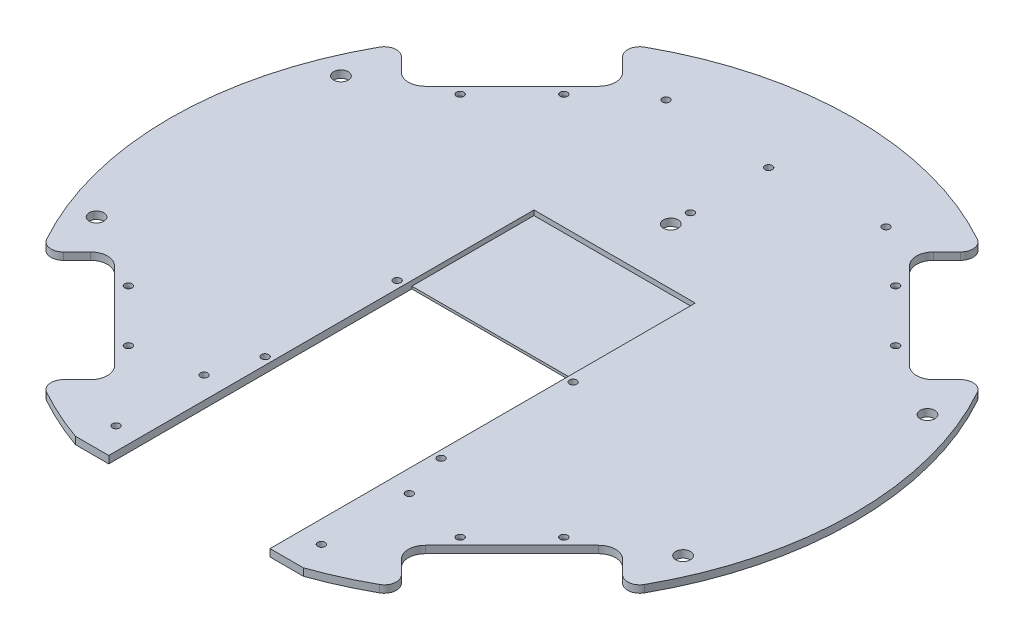
from build123d import *

# Parameters (mm, degrees)
SKETCH1_R                = 140
BOSS_EXTRUDE1_DEPTH      = 3
CUT_EXTRUDE4_REACH       = 200.013
CUT_EXTRUDE6_REACH       = 200.013
SKETCH9_R                = 1.5
FILLET1_R                = 5
CIRPATTERN1_COUNT        = 4
FILLET1_OF_CIRPATTERN1_R = 5
CUT_EXTRUDE1_REACH       = 200.013
FILLET3_R                = 1.5
CUT_EXTRUDE7_REACH       = 200.013
SKETCH10_R               = 1.5
CUT_EXTRUDE9_REACH       = 200.013
SKETCH13_R               = 1.5
CUT_EXTRUDE12_REACH      = 200.013
SKETCH16_R               = 1.5
SKETCH16_R_2             = 3
CUT_EXTRUDE13_REACH      = 200.013
SKETCH17_R               = 3
SKETCH18_W               = 66
SKETCH18_H               = 50
CUT_EXTRUDE14_DEPTH      = 2


with BuildPart() as part:
    # Sketch1 → Boss-Extrude1 (new body)
    with BuildSketch(Plane(origin=(0, 0, 0), x_dir=(1, 0, 0), z_dir=(0, 1, 0))):
        Circle(SKETCH1_R)
    extrude(amount=BOSS_EXTRUDE1_DEPTH)

    # Sketch7 → Cut-Extrude4 (cut, up to next)
    with BuildSketch(Plane(origin=(0, 3, 0), x_dir=(1, 0, 0), z_dir=(0, 1, 0)), mode=Mode.PRIVATE) as cut_extrude4_sk1:
        with BuildLine():
            Line((-99.030304705, -63.604254968), (-63.604254968, -99.030304705))
            ThreePointArc((-63.604254968, -99.030304705), (-61.568647097, -103.944696834), (-63.604254968, -108.859088964))
            Line((-63.604254968, -108.859088964), (-76.367532368, -121.622366364))
            Line((-76.367532368, -121.622366364), (-121.622366364, -76.367532368))
            Line((-121.622366364, -76.367532368), (-108.859088964, -63.604254968))
            ThreePointArc((-108.859088964, -63.604254968), (-103.944696834, -61.568647097), (-99.030304705, -63.604254968))
        make_face()
    cut_extrude4_tool1 = extrude(cut_extrude4_sk1.sketch, amount=-CUT_EXTRUDE4_REACH, mode=Mode.PRIVATE) & part.part
    cut_extrude4 = cut_extrude4_tool1.solids().sort_by_distance((-90.257735, 3, 90.257735))[0]
    add(cut_extrude4, mode=Mode.SUBTRACT)

    # Sketch9 → Cut-Extrude6 (cut, up to next)
    with BuildSketch(Plane(origin=(0, 3, 0), x_dir=(1, 0, 0), z_dir=(0, 1, 0)), mode=Mode.PRIVATE) as cut_extrude6_sk1:
        with Locations((-89.09545443, -67.882250994)):
            Circle(SKETCH9_R)
    cut_extrude6_tool1 = extrude(cut_extrude6_sk1.sketch, amount=-CUT_EXTRUDE6_REACH, mode=Mode.PRIVATE) & part.part
    # Sketch9 → Cut-Extrude6 (cut, up to next)
    with BuildSketch(Plane(origin=(0, 3, 0), x_dir=(1, 0, 0), z_dir=(0, 1, 0)), mode=Mode.PRIVATE) as cut_extrude6_sk2:
        with Locations((-67.882250994, -89.09545443)):
            Circle(SKETCH9_R)
    cut_extrude6_tool2 = extrude(cut_extrude6_sk2.sketch, amount=-CUT_EXTRUDE6_REACH, mode=Mode.PRIVATE) & part.part
    cut_extrude6_1 = cut_extrude6_tool1.solids().sort_by_distance((-89.095454, 3, 67.882251))[0]
    add(cut_extrude6_1, mode=Mode.SUBTRACT)
    cut_extrude6_2 = cut_extrude6_tool2.solids().sort_by_distance((-67.882251, 3, 89.095454))[0]
    add(cut_extrude6_2, mode=Mode.SUBTRACT)
    cut_extrude6 = cut_extrude6_1 + cut_extrude6_2  # Cut-Extrude6 as one shape, for the pattern or mirror that repeats it

    # Fillet1
    fillet1_edges = [part.edges().sort_by_distance(p)[0] for p in [
        (-73.746853427, 1.5, 119.001687423),
        (-119.001687423, 1.5, 73.746853427),
    ]]
    fillet(fillet1_edges, radius=FILLET1_R)

    # CirPattern1: Cut-Extrude4, Cut-Extrude6 ×4 about axis
    cirpattern1_axis = Axis((0, 3, 0), (0, 1, 0))
    add([cut_extrude4.rotate(cirpattern1_axis, i * 360 / CIRPATTERN1_COUNT) for i in range(1, CIRPATTERN1_COUNT)], mode=Mode.SUBTRACT)
    add([cut_extrude6.rotate(cirpattern1_axis, i * 360 / CIRPATTERN1_COUNT) for i in range(1, CIRPATTERN1_COUNT)], mode=Mode.SUBTRACT)

    # Fillet1 of CirPattern1
    fillet1_of_cirpattern1_edges = [part.edges().sort_by_distance(p)[0] for p in [
        (119.001687423, 1.5, 73.746853427),
        (73.746853427, 1.5, 119.001687423),
        (73.746853427, 1.5, -119.001687423),
        (119.001687423, 1.5, -73.746853427),
        (-119.001687423, 1.5, -73.746853427),
        (-73.746853427, 1.5, -119.001687423),
    ]]
    fillet(fillet1_of_cirpattern1_edges, radius=FILLET1_OF_CIRPATTERN1_R)

    # Sketch2 → Cut-Extrude1 (cut, up to next)
    with BuildSketch(Plane(origin=(0, 3, 0), x_dir=(1, 0, 0), z_dir=(0, 1, 0)), mode=Mode.PRIVATE) as cut_extrude1_sk1:
        Polygon((-46.647615159, -132), (-33, -132), (-33, -8), (33, -8), (33, -132), (46.647615159, -132), (46.647615159, -140), (-46.647615159, -140), align=None)
    cut_extrude1_tool1 = extrude(cut_extrude1_sk1.sketch, amount=-CUT_EXTRUDE1_REACH, mode=Mode.PRIVATE) & part.part
    add(cut_extrude1_tool1.solids().sort_by_distance((0, 3, 75.516001))[0], mode=Mode.SUBTRACT)

    # Fillet3
    fillet3_edges = [part.edges().sort_by_distance(p)[0] for p in [
        (67.882250994, 0, 90.59545443),
        (89.09545443, 0, 69.382250994),
        (90.59545443, 0, -67.882250994),
        (69.382250994, 0, -89.09545443),
        (-67.882250994, 0, -90.59545443),
        (-89.09545443, 0, -69.382250994),
        (-69.382250994, 0, 89.09545443),
        (-90.59545443, 0, 67.882250994),
    ]]
    fillet(fillet3_edges, radius=FILLET3_R)

    # Sketch10 → Cut-Extrude7 (cut, up to next)
    with BuildSketch(Plane(origin=(0, 3, 0), x_dir=(1, 0, 0), z_dir=(0, 1, 0)), mode=Mode.PRIVATE) as cut_extrude7_sk1:
        with Locations((-36, -65)):
            Circle(SKETCH10_R)
    cut_extrude7_tool1 = extrude(cut_extrude7_sk1.sketch, amount=-CUT_EXTRUDE7_REACH, mode=Mode.PRIVATE) & part.part
    # Sketch10 → Cut-Extrude7 (cut, up to next)
    with BuildSketch(Plane(origin=(0, 3, 0), x_dir=(1, 0, 0), z_dir=(0, 1, 0)), mode=Mode.PRIVATE) as cut_extrude7_sk2:
        with Locations((36, -65)):
            Circle(SKETCH10_R)
    cut_extrude7_tool2 = extrude(cut_extrude7_sk2.sketch, amount=-CUT_EXTRUDE7_REACH, mode=Mode.PRIVATE) & part.part
    # Sketch10 → Cut-Extrude7 (cut, up to next)
    with BuildSketch(Plane(origin=(0, 3, 0), x_dir=(1, 0, 0), z_dir=(0, 1, 0)), mode=Mode.PRIVATE) as cut_extrude7_sk3:
        with Locations((-36, -11)):
            Circle(SKETCH10_R)
    cut_extrude7_tool3 = extrude(cut_extrude7_sk3.sketch, amount=-CUT_EXTRUDE7_REACH, mode=Mode.PRIVATE) & part.part
    # Sketch10 → Cut-Extrude7 (cut, up to next)
    with BuildSketch(Plane(origin=(0, 3, 0), x_dir=(1, 0, 0), z_dir=(0, 1, 0)), mode=Mode.PRIVATE) as cut_extrude7_sk4:
        with Locations((36, -11)):
            Circle(SKETCH10_R)
    cut_extrude7_tool4 = extrude(cut_extrude7_sk4.sketch, amount=-CUT_EXTRUDE7_REACH, mode=Mode.PRIVATE) & part.part
    add(cut_extrude7_tool1.solids().sort_by_distance((-36, 3, 65))[0], mode=Mode.SUBTRACT)
    add(cut_extrude7_tool2.solids().sort_by_distance((36, 3, 65))[0], mode=Mode.SUBTRACT)
    add(cut_extrude7_tool3.solids().sort_by_distance((-36, 3, 11))[0], mode=Mode.SUBTRACT)
    add(cut_extrude7_tool4.solids().sort_by_distance((36, 3, 11))[0], mode=Mode.SUBTRACT)

    # Sketch13 → Cut-Extrude9 (cut, up to next)
    with BuildSketch(Plane(origin=(0, 3, 0), x_dir=(1, 0, 0), z_dir=(0, 1, 0)), mode=Mode.PRIVATE) as cut_extrude9_sk1:
        with Locations((-42, -84)):
            Circle(SKETCH13_R)
    cut_extrude9_tool1 = extrude(cut_extrude9_sk1.sketch, amount=-CUT_EXTRUDE9_REACH, mode=Mode.PRIVATE) & part.part
    # Sketch13 → Cut-Extrude9 (cut, up to next)
    with BuildSketch(Plane(origin=(0, 3, 0), x_dir=(1, 0, 0), z_dir=(0, 1, 0)), mode=Mode.PRIVATE) as cut_extrude9_sk2:
        with Locations((-42, -120)):
            Circle(SKETCH13_R)
    cut_extrude9_tool2 = extrude(cut_extrude9_sk2.sketch, amount=-CUT_EXTRUDE9_REACH, mode=Mode.PRIVATE) & part.part
    # Sketch13 → Cut-Extrude9 (cut, up to next)
    with BuildSketch(Plane(origin=(0, 3, 0), x_dir=(1, 0, 0), z_dir=(0, 1, 0)), mode=Mode.PRIVATE) as cut_extrude9_sk3:
        with Locations((42, -120)):
            Circle(SKETCH13_R)
    cut_extrude9_tool3 = extrude(cut_extrude9_sk3.sketch, amount=-CUT_EXTRUDE9_REACH, mode=Mode.PRIVATE) & part.part
    # Sketch13 → Cut-Extrude9 (cut, up to next)
    with BuildSketch(Plane(origin=(0, 3, 0), x_dir=(1, 0, 0), z_dir=(0, 1, 0)), mode=Mode.PRIVATE) as cut_extrude9_sk4:
        with Locations((42, -84)):
            Circle(SKETCH13_R)
    cut_extrude9_tool4 = extrude(cut_extrude9_sk4.sketch, amount=-CUT_EXTRUDE9_REACH, mode=Mode.PRIVATE) & part.part
    add(cut_extrude9_tool1.solids().sort_by_distance((-42, 3, 84))[0], mode=Mode.SUBTRACT)
    add(cut_extrude9_tool2.solids().sort_by_distance((-42, 3, 120))[0], mode=Mode.SUBTRACT)
    add(cut_extrude9_tool3.solids().sort_by_distance((42, 3, 120))[0], mode=Mode.SUBTRACT)
    add(cut_extrude9_tool4.solids().sort_by_distance((42, 3, 84))[0], mode=Mode.SUBTRACT)

    # Sketch16 → Cut-Extrude12 (cut, up to next)
    with BuildSketch(Plane(origin=(0, 3, 0), x_dir=(1, 0, 0), z_dir=(0, 1, 0)), mode=Mode.PRIVATE) as cut_extrude12_sk1:
        with Locations((0, 73)):
            Circle(SKETCH16_R)
    cut_extrude12_tool1 = extrude(cut_extrude12_sk1.sketch, amount=-CUT_EXTRUDE12_REACH, mode=Mode.PRIVATE) & part.part
    # Sketch16 → Cut-Extrude12 (cut, up to next)
    with BuildSketch(Plane(origin=(0, 3, 0), x_dir=(1, 0, 0), z_dir=(0, 1, 0)), mode=Mode.PRIVATE) as cut_extrude12_sk2:
        with Locations((-45, 108)):
            Circle(SKETCH16_R)
    cut_extrude12_tool2 = extrude(cut_extrude12_sk2.sketch, amount=-CUT_EXTRUDE12_REACH, mode=Mode.PRIVATE) & part.part
    # Sketch16 → Cut-Extrude12 (cut, up to next)
    with BuildSketch(Plane(origin=(0, 3, 0), x_dir=(1, 0, 0), z_dir=(0, 1, 0)), mode=Mode.PRIVATE) as cut_extrude12_sk3:
        with Locations((45, 108)):
            Circle(SKETCH16_R)
    cut_extrude12_tool3 = extrude(cut_extrude12_sk3.sketch, amount=-CUT_EXTRUDE12_REACH, mode=Mode.PRIVATE) & part.part
    # Sketch16 → Cut-Extrude12 (cut, up to next)
    with BuildSketch(Plane(origin=(0, 3, 0), x_dir=(1, 0, 0), z_dir=(0, 1, 0)), mode=Mode.PRIVATE) as cut_extrude12_sk4:
        with Locations((0, 105)):
            Circle(SKETCH16_R)
    cut_extrude12_tool4 = extrude(cut_extrude12_sk4.sketch, amount=-CUT_EXTRUDE12_REACH, mode=Mode.PRIVATE) & part.part
    # Sketch16 → Cut-Extrude12 (cut, up to next)
    with BuildSketch(Plane(origin=(0, 3, 0), x_dir=(1, 0, 0), z_dir=(0, 1, 0)), mode=Mode.PRIVATE) as cut_extrude12_sk5:
        with Locations((0, 65)):
            Circle(SKETCH16_R_2)
    cut_extrude12_tool5 = extrude(cut_extrude12_sk5.sketch, amount=-CUT_EXTRUDE12_REACH, mode=Mode.PRIVATE) & part.part
    add(cut_extrude12_tool1.solids().sort_by_distance((0, 3, -73))[0], mode=Mode.SUBTRACT)
    add(cut_extrude12_tool2.solids().sort_by_distance((-45, 3, -108))[0], mode=Mode.SUBTRACT)
    add(cut_extrude12_tool3.solids().sort_by_distance((45, 3, -108))[0], mode=Mode.SUBTRACT)
    add(cut_extrude12_tool4.solids().sort_by_distance((0, 3, -105))[0], mode=Mode.SUBTRACT)
    add(cut_extrude12_tool5.solids().sort_by_distance((0, 3, -65))[0], mode=Mode.SUBTRACT)

    # Sketch17 → Cut-Extrude13 (cut, up to next)
    with BuildSketch(Plane(origin=(0, 3, 0), x_dir=(1, 0, 0), z_dir=(0, 1, 0)), mode=Mode.PRIVATE) as cut_extrude13_sk1:
        with Locations((-120, 50)):
            Circle(SKETCH17_R)
    cut_extrude13_tool1 = extrude(cut_extrude13_sk1.sketch, amount=-CUT_EXTRUDE13_REACH, mode=Mode.PRIVATE) & part.part
    # Sketch17 → Cut-Extrude13 (cut, up to next)
    with BuildSketch(Plane(origin=(0, 3, 0), x_dir=(1, 0, 0), z_dir=(0, 1, 0)), mode=Mode.PRIVATE) as cut_extrude13_sk2:
        with Locations((-120, -50)):
            Circle(SKETCH17_R)
    cut_extrude13_tool2 = extrude(cut_extrude13_sk2.sketch, amount=-CUT_EXTRUDE13_REACH, mode=Mode.PRIVATE) & part.part
    # Sketch17 → Cut-Extrude13 (cut, up to next)
    with BuildSketch(Plane(origin=(0, 3, 0), x_dir=(1, 0, 0), z_dir=(0, 1, 0)), mode=Mode.PRIVATE) as cut_extrude13_sk3:
        with Locations((120, 50)):
            Circle(SKETCH17_R)
    cut_extrude13_tool3 = extrude(cut_extrude13_sk3.sketch, amount=-CUT_EXTRUDE13_REACH, mode=Mode.PRIVATE) & part.part
    # Sketch17 → Cut-Extrude13 (cut, up to next)
    with BuildSketch(Plane(origin=(0, 3, 0), x_dir=(1, 0, 0), z_dir=(0, 1, 0)), mode=Mode.PRIVATE) as cut_extrude13_sk4:
        with Locations((120, -50)):
            Circle(SKETCH17_R)
    cut_extrude13_tool4 = extrude(cut_extrude13_sk4.sketch, amount=-CUT_EXTRUDE13_REACH, mode=Mode.PRIVATE) & part.part
    add(cut_extrude13_tool1.solids().sort_by_distance((-120, 3, -50))[0], mode=Mode.SUBTRACT)
    add(cut_extrude13_tool2.solids().sort_by_distance((-120, 3, 50))[0], mode=Mode.SUBTRACT)
    add(cut_extrude13_tool3.solids().sort_by_distance((120, 3, -50))[0], mode=Mode.SUBTRACT)
    add(cut_extrude13_tool4.solids().sort_by_distance((120, 3, 50))[0], mode=Mode.SUBTRACT)

    # Sketch18 → Cut-Extrude14 (cut)
    with BuildSketch(Plane(origin=(0, 3, 0), x_dir=(1, 0, 0), z_dir=(0, 1, 0))):
        with Locations((0, 17)):
            Rectangle(SKETCH18_W, SKETCH18_H)
    extrude(amount=-CUT_EXTRUDE14_DEPTH, mode=Mode.SUBTRACT)


solid = part.part
